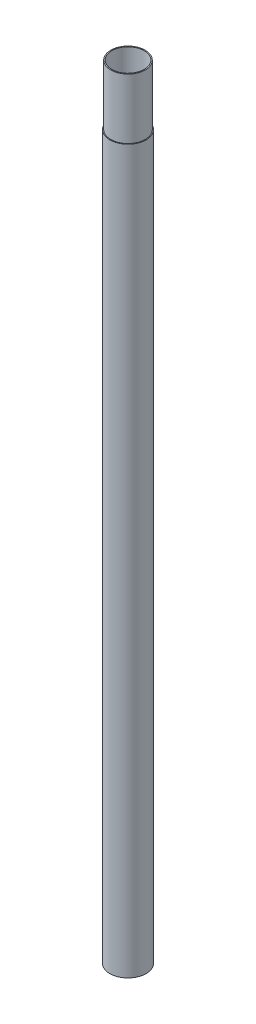
from build123d import *

# Parameters (mm, degrees)
SKETCH1_R           = 15
SKETCH1_R_2         = 13.462
BOSS_EXTRUDE1_DEPTH = 600
SKETCH4_R           = 14.3
SKETCH4_R_2         = 13.462
BOSS_EXTRUDE5_DEPTH = 50


with BuildPart() as part:
    # Sketch1 → Boss-Extrude1 (new body)
    with BuildSketch(Plane(origin=(0, 0, 0), x_dir=(1, 0, 0), z_dir=(0, 1, 0))):
        Circle(SKETCH1_R)
        Circle(SKETCH1_R_2, mode=Mode.SUBTRACT)
    extrude(amount=BOSS_EXTRUDE1_DEPTH)

    # Sketch4 → Boss-Extrude5 (add)
    with BuildSketch(Plane(origin=(0, 600, 0), x_dir=(1, 0, 0), z_dir=(0, 1, 0))):
        Circle(SKETCH4_R)
        Circle(SKETCH4_R_2, mode=Mode.SUBTRACT)
    extrude(amount=BOSS_EXTRUDE5_DEPTH)


solid = part.part
